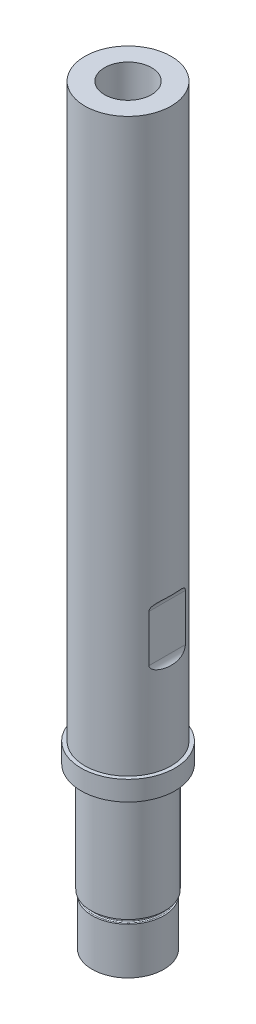
from build123d import *
from build123d.topology import SkipClean

# Parameters (mm, degrees)
SKETCH1_R               = 22.5
SKETCH1_R_2             = 9.525
BOSS_EXTRUDE1_DEPTH     = 95
SKETCH2_OUTSIDE_W       = 69.87
SKETCH2_OUTSIDE_H       = 69.87
SKETCH2_OUTSIDE_R       = 15
CUT_EXTRUDE1_DEPTH      = 50
SKETCH4_OUTSIDE_W       = 69.87
SKETCH4_OUTSIDE_H       = 69.87
SKETCH4_OUTSIDE_R       = 17.5
CUT_EXTRUDE2_DEPTH      = 37
SKETCH11_OUTSIDE_W      = 69.87
SKETCH11_OUTSIDE_H      = 69.87
SKETCH11_OUTSIDE_R      = 14.513
CUT_EXTRUDE3_DEPTH      = 5.88
SKETCH12_R              = 17.5
SKETCH12_R_2            = 9.525
BOSS_EXTRUDE2_DEPTH     = 203.2
BOSS_EXTRUDE3_START     = 15
SKETCH13_R              = 14.513
SKETCH13_R_2            = 9.525
BOSS_EXTRUDE3_DEPTH     = 15
SKETCH15_OUTSIDE_W      = 110.92
SKETCH15_OUTSIDE_H      = 110.92
SKETCH15_OUTSIDE_R      = 19.05
CUT_EXTRUDE5_DEPTH      = 251.231372933
SKETCH16_OUTSIDE_W      = 103.66
SKETCH16_OUTSIDE_H      = 103.66
SKETCH16_OUTSIDE_R      = 13.5
CUT_EXTRUDE6_DEPTH      = 2
FILLET2_R               = 0.396875
SKETCH17_R              = 17.5
CUT_EXTRUDE7_DEPTH      = 8.4
CUT_EXTRUDE8_DEPTH      = 292.049557636
CUT_EXTRUDE8_DEPTH_BACK = 292.049557636
SKETCH20_W              = 3.175
SKETCH20_H              = 25.4
FILLET3_R               = 3.175


with BuildPart() as part:
    # Sketch1 → Boss-Extrude1 (new body)
    with BuildSketch(Plane(origin=(0, 0, 0), x_dir=(1, 0, 0), z_dir=(0, 1, 0))):
        with Locations(Location((0, 0, 0), (0, 0, 270))):
            Circle(SKETCH1_R)
        with Locations(Location((0, 0, 0), (0, 0, 270))):
            Circle(SKETCH1_R_2, mode=Mode.SUBTRACT)
    extrude(amount=BOSS_EXTRUDE1_DEPTH)

    # Sketch2 outside → Cut-Extrude1 (cut)
    with BuildSketch(Plane.XZ):
        Rectangle(SKETCH2_OUTSIDE_W, SKETCH2_OUTSIDE_H)
        with Locations(Location((0, 0, 0), (0, 0, 270))):
            Circle(SKETCH2_OUTSIDE_R, mode=Mode.SUBTRACT)
    extrude(amount=-CUT_EXTRUDE1_DEPTH, mode=Mode.SUBTRACT)

    # Sketch4 outside → Cut-Extrude2 (cut)
    with BuildSketch(Plane(origin=(0, 95, 0), x_dir=(1, 0, 0), z_dir=(0, 1, 0))):
        Rectangle(SKETCH4_OUTSIDE_W, SKETCH4_OUTSIDE_H)
        with Locations(Location((0, 0, 0), (0, 0, 270))):
            Circle(SKETCH4_OUTSIDE_R, mode=Mode.SUBTRACT)
    extrude(amount=-CUT_EXTRUDE2_DEPTH, mode=Mode.SUBTRACT)

    # Sketch11 outside → Cut-Extrude3 (cut)
    with BuildSketch(Plane.XZ):
        Rectangle(SKETCH11_OUTSIDE_W, SKETCH11_OUTSIDE_H)
        with Locations(Location((0, 0, 0), (0, 0, 270))):
            Circle(SKETCH11_OUTSIDE_R, mode=Mode.SUBTRACT)
    extrude(amount=-CUT_EXTRUDE3_DEPTH, mode=Mode.SUBTRACT)

    # Sketch12 → Boss-Extrude2 (add)
    with BuildSketch(Plane(origin=(0, 95, 0), x_dir=(1, 0, 0), z_dir=(0, 1, 0))):
        with Locations(Location((0, 0, 0), (0, 0, 270))):
            Circle(SKETCH12_R)
        with Locations(Location((0, 0, 0), (0, 0, 270))):
            Circle(SKETCH12_R_2, mode=Mode.SUBTRACT)
    extrude(amount=BOSS_EXTRUDE2_DEPTH)

    # Sketch13 → Boss-Extrude3 (add)
    with SkipClean():  # the faces are left unmerged after this step: merging them gives an invalid solid
        with BuildSketch(Plane.XZ.offset(BOSS_EXTRUDE3_START)):
            with Locations(Location((0, 0, 0), (0, 0, 270))):
                Circle(SKETCH13_R)
            with Locations(Location((0, 0, 0), (0, 0, 270))):
                Circle(SKETCH13_R_2, mode=Mode.SUBTRACT)
        extrude(amount=-BOSS_EXTRUDE3_DEPTH)

    # Sketch15 outside → Cut-Extrude5 (cut, through all)
    with SkipClean():  # the faces are left unmerged after this step: merging them gives an invalid solid
        with BuildSketch(Plane.XZ.offset(-50)):
            Rectangle(SKETCH15_OUTSIDE_W, SKETCH15_OUTSIDE_H)
            with Locations(Location((0, 0, 0), (0, 0, 270))):
                Circle(SKETCH15_OUTSIDE_R, mode=Mode.SUBTRACT)
        extrude(amount=-CUT_EXTRUDE5_DEPTH, mode=Mode.SUBTRACT)

    # Sketch16 outside → Cut-Extrude6 (cut)
    with SkipClean():  # the faces are left unmerged after this step: merging them gives an invalid solid
        with BuildSketch(Plane.XZ.offset(-5.88)):
            Rectangle(SKETCH16_OUTSIDE_W, SKETCH16_OUTSIDE_H)
            with Locations(Location((0, 0, 0), (0, 0, 270))):
                Circle(SKETCH16_OUTSIDE_R, mode=Mode.SUBTRACT)
        extrude(amount=CUT_EXTRUDE6_DEPTH, mode=Mode.SUBTRACT)

    # Fillet2
    fillet2_edges = [part.edges().sort_by_distance(p)[0] for p in [
        (0, 5.88, 13.5),
        (0, 3.88, 13.5),
    ]]
    fillet(fillet2_edges, radius=FILLET2_R)

    # Sketch17 → Cut-Extrude7 (cut)
    with BuildSketch(Plane(origin=(0, 298.2, 0), x_dir=(1, 0, 0), z_dir=(0, 1, 0))):
        with Locations(Location((0, 0, 0), (0, 0, 270))):
            Circle(SKETCH17_R)
    extrude(amount=-CUT_EXTRUDE7_DEPTH, mode=Mode.SUBTRACT)

    # Sketch20 → Cut-Extrude8 (cut, two sides: drawn at the far end of the back side and taken through both)
    with BuildSketch(Plane.XY.offset(-CUT_EXTRUDE8_DEPTH_BACK)):
        with Locations((-17.4625, 105.625)):
            Rectangle(SKETCH20_W, SKETCH20_H)
        with Locations((17.4625, 105.625)):
            Rectangle(SKETCH20_W, SKETCH20_H)
    extrude(amount=CUT_EXTRUDE8_DEPTH + CUT_EXTRUDE8_DEPTH_BACK, mode=Mode.SUBTRACT)

    # Fillet3
    # the kernel refuses this fillet: 3.175 mm, written as the material it adds along each edge
    with BuildSketch(Plane(origin=(-15.875, 92.925, 15.301899161), x_dir=(0, 1, 0), z_dir=(0, 0, -1))) as fillet3_piece_1_section:
        with BuildLine():
            CenterArc((FILLET3_R, -FILLET3_R), FILLET3_R, 90, 90)
            Line((0, -FILLET3_R), (0, 0))
            Line((0, 0), (FILLET3_R, 0))
        make_face()
    fillet3_piece_1 = extrude(amount=30.603798322, mode=Mode.PRIVATE)
    fillet3_piece_1 = fillet3_piece_1 & Plane(origin=(0, 93.819377515, 0), x_dir=(0, 0, 1), z_dir=(0, 1, 0)) * Cylinder(17.5, 74, mode=Mode.PRIVATE)
    add(fillet3_piece_1)
    with BuildSketch(Plane(origin=(-15.875, 118.325, 15.301899161), x_dir=(0, -1, 0), z_dir=(0, 0, -1))) as fillet3_piece_2_section:
        with BuildLine():
            CenterArc((FILLET3_R, FILLET3_R), FILLET3_R, 180, 90)
            Line((0, FILLET3_R), (0, 0))
            Line((0, 0), (FILLET3_R, 0))
        make_face()
    fillet3_piece_2 = extrude(amount=30.603798322, mode=Mode.PRIVATE)
    fillet3_piece_2 = fillet3_piece_2 & Plane(origin=(0, 117.430622485, 0), x_dir=(0, 0, 1), z_dir=(0, 1, 0)) * Cylinder(17.5, 74, mode=Mode.PRIVATE)
    add(fillet3_piece_2)
    with BuildSketch(Plane(origin=(15.875, 92.925, -15.301899161), x_dir=(0, 1, 0), z_dir=(0, 0, 1))) as fillet3_piece_3_section:
        with BuildLine():
            CenterArc((FILLET3_R, -FILLET3_R), FILLET3_R, 90, 90)
            Line((0, -FILLET3_R), (0, 0))
            Line((0, 0), (FILLET3_R, 0))
        make_face()
    fillet3_piece_3 = extrude(amount=30.603798322, mode=Mode.PRIVATE)
    fillet3_piece_3 = fillet3_piece_3 & Plane(origin=(0, 93.81935464, 0), x_dir=(0, 0, 1), z_dir=(0, 1, 0)) * Cylinder(17.5, 74, mode=Mode.PRIVATE)
    add(fillet3_piece_3)
    with BuildSketch(Plane(origin=(15.875, 118.325, -15.301899161), x_dir=(0, -1, 0), z_dir=(0, 0, 1))) as fillet3_piece_4_section:
        with BuildLine():
            CenterArc((FILLET3_R, FILLET3_R), FILLET3_R, 180, 90)
            Line((0, FILLET3_R), (0, 0))
            Line((0, 0), (FILLET3_R, 0))
        make_face()
    fillet3_piece_4 = extrude(amount=30.603798322, mode=Mode.PRIVATE)
    fillet3_piece_4 = fillet3_piece_4 & Plane(origin=(0, 117.43064536, 0), x_dir=(0, 0, 1), z_dir=(0, 1, 0)) * Cylinder(17.5, 74, mode=Mode.PRIVATE)
    add(fillet3_piece_4)


solid = part.part
